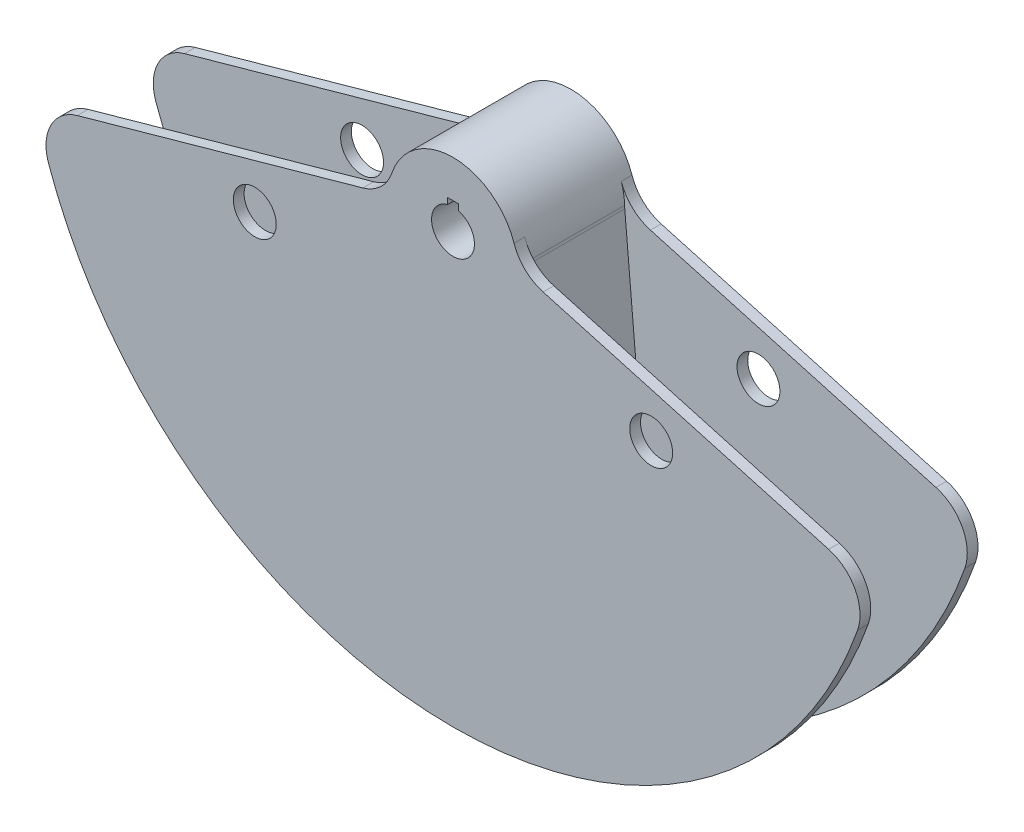
from build123d import *

# Parameters (mm, degrees)
SKETCH1_R               = 12.7
BOSS_EXTRUDE1_DEPTH     = 28.575
BOSS_EXTRUDE2_START     = 6.35
SKETCH5_R               = 12.7
BOSS_EXTRUDE2_DEPTH     = 6.35
SKETCH6_R               = 12.7
BOSS_EXTRUDE4_DEPTH     = 6.35
CUT_EXTRUDE1_DEPTH      = 352.838871056
CUT_EXTRUDE1_DEPTH_BACK = 352.838871056
SKETCH8_W               = 6.35
SKETCH8_H               = 6.35


with BuildPart() as part:
    # Sketch1 → Boss-Extrude1 (new, symmetric)
    with BuildSketch(Plane.XY):
        with BuildLine():
            Line((-59.699595301, -246.884504011), (-38.184359795, -0.964236874))
            ThreePointArc((-38.184359795, -0.964236874), (-38.124009824, -0.108037848), (-38.092623076, 0.749711395))
            ThreePointArc((-38.092623076, 0.749711395), (0, 38.1), (38.092623076, 0.749711395))
            ThreePointArc((38.092623076, 0.749711395), (38.124009824, -0.108037848), (38.184359795, -0.964236874))
            Line((38.184359795, -0.964236874), (59.699595301, -246.884504011))
            ThreePointArc((59.699595301, -246.884504011), (0, -254), (-59.699595301, -246.884504011))
        make_face()
        Circle(SKETCH1_R, mode=Mode.SUBTRACT)
    extrude(amount=BOSS_EXTRUDE1_DEPTH, both=True)

    # Sketch5 → Boss-Extrude2 (add)
    with BuildSketch(Plane.XY.offset(28.575).offset(BOSS_EXTRUDE2_START)):
        with BuildLine():
            Line((-222.404517395, -51.688216293), (-53.349403067, -4.276696281))
            ThreePointArc((-53.349403067, -4.276696281), (-42.702025606, 1.776101798), (-36.124925788, 12.107837827))
            ThreePointArc((-36.124925788, 12.107837827), (0, 38.1), (36.124925788, 12.107837827))
            ThreePointArc((36.124925788, 12.107837827), (42.702025606, 1.776101798), (53.349403067, -4.276696281))
            Line((53.349403067, -4.276696281), (222.404517395, -51.688216293))
            ThreePointArc((222.404517395, -51.688216293), (238.08832743, -64.440350927), (239.49523424, -84.605158095))
            ThreePointArc((239.49523424, -84.605158095), (0, -254), (-239.49523424, -84.605158095))
            ThreePointArc((-239.49523424, -84.605158095), (-238.08832743, -64.440350927), (-222.404517395, -51.688216293))
        make_face()
        Circle(SKETCH5_R, mode=Mode.SUBTRACT)
        with Locations((-117.332700629, -48.60079591)):
            Circle(SKETCH5_R, mode=Mode.SUBTRACT)
        with Locations((117.332700629, -48.60079591)):
            Circle(SKETCH5_R, mode=Mode.SUBTRACT)
    extrude(amount=-BOSS_EXTRUDE2_DEPTH)

    # Sketch6 → Boss-Extrude4 (add)
    with BuildSketch(Plane(origin=(0, 0, -28.575), x_dir=(-1, 0, 0), z_dir=(0, 0, -1))):
        with BuildLine():
            Line((-222.404517395, -51.688216293), (-53.349403067, -4.276696281))
            ThreePointArc((-53.349403067, -4.276696281), (-42.702025606, 1.776101798), (-36.124925788, 12.107837827))
            ThreePointArc((-36.124925788, 12.107837827), (0, 38.1), (36.124925788, 12.107837827))
            ThreePointArc((36.124925788, 12.107837827), (42.702025606, 1.776101798), (53.349403067, -4.276696281))
            Line((53.349403067, -4.276696281), (222.404517395, -51.688216293))
            ThreePointArc((222.404517395, -51.688216293), (238.08832743, -64.440350927), (239.49523424, -84.605158095))
            ThreePointArc((239.49523424, -84.605158095), (0, -254), (-239.49523424, -84.605158095))
            ThreePointArc((-239.49523424, -84.605158095), (-238.08832743, -64.440350927), (-222.404517395, -51.688216293))
        make_face()
        Circle(SKETCH6_R, mode=Mode.SUBTRACT)
        with Locations((-117.332700629, -48.60079591)):
            Circle(SKETCH6_R, mode=Mode.SUBTRACT)
        with Locations((117.332700629, -48.60079591)):
            Circle(SKETCH6_R, mode=Mode.SUBTRACT)
    extrude(amount=BOSS_EXTRUDE4_DEPTH)

    # Sketch8 → Cut-Extrude1 (cut, two sides: drawn at the far end of the back side and taken through both)
    with BuildSketch(Plane.XY.offset(-CUT_EXTRUDE1_DEPTH_BACK)):
        with Locations((0, 12.7)):
            Rectangle(SKETCH8_W, SKETCH8_H)
    extrude(amount=CUT_EXTRUDE1_DEPTH + CUT_EXTRUDE1_DEPTH_BACK, mode=Mode.SUBTRACT)


solid = part.part
